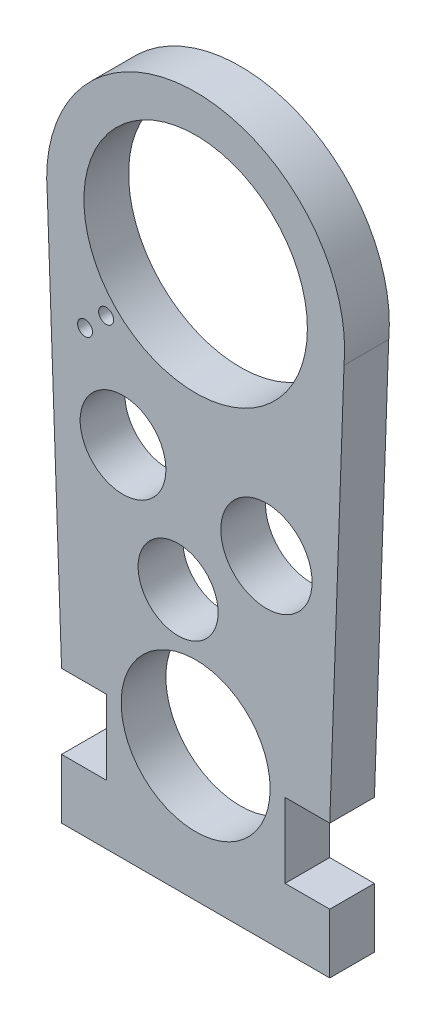
from build123d import *

# Parameters (mm, degrees)
ESQUISSE1_R        = 5
ESQUISSE1_R_2      = 2.877506478
ESQUISSE1_R_3      = 3.063484505
ESQUISSE1_R_4      = 2.684325632
ESQUISSE1_R_5      = 0.5
ESQUISSE1_R_6      = 7.5
BOSS_EXTRU_1_DEPTH = 3


with BuildPart() as part:
    # Esquisse1 → Boss.-Extru.1 (new body)
    with BuildSketch(Plane.XY):
        with BuildLine():
            Line((6, 0), (9, 0))
            Line((9, 0), (9.959071707, 27.096179922))
            ThreePointArc((9.959071707, 27.096179922), (0, 38), (-9.959071707, 27.096179922))
            Line((-9.959071707, 27.096179922), (-9, 0))
            Line((-9, 0), (-6, 0))
            Line((-6, 0), (-6, -5))
            Line((-6, -5), (-9, -5))
            Line((-9, -5), (-9, -9))
            Line((-9, -9), (9, -9))
            Line((9, -9), (9, -5))
            Line((9, -5), (6, -5))
            Line((6, -5), (6, 0))
        make_face()
        Circle(ESQUISSE1_R, mode=Mode.SUBTRACT)
        with Locations((-4.874230419, 15.048067775)):
            Circle(ESQUISSE1_R_2, mode=Mode.SUBTRACT)
        with Locations((4.750736526, 13.416152965)):
            Circle(ESQUISSE1_R_3, mode=Mode.SUBTRACT)
        with Locations((-1.177443807, 8.487104148)):
            Circle(ESQUISSE1_R_4, mode=Mode.SUBTRACT)
        with Locations((-7.424621202, 20.575378798)):
            Circle(ESQUISSE1_R_5, mode=Mode.SUBTRACT)
        with Locations((-6.01040764, 21.98959236)):
            Circle(ESQUISSE1_R_5, mode=Mode.SUBTRACT)
        with Locations((0, 28)):
            Circle(ESQUISSE1_R_6, mode=Mode.SUBTRACT)
    extrude(amount=BOSS_EXTRU_1_DEPTH)


solid = part.part
